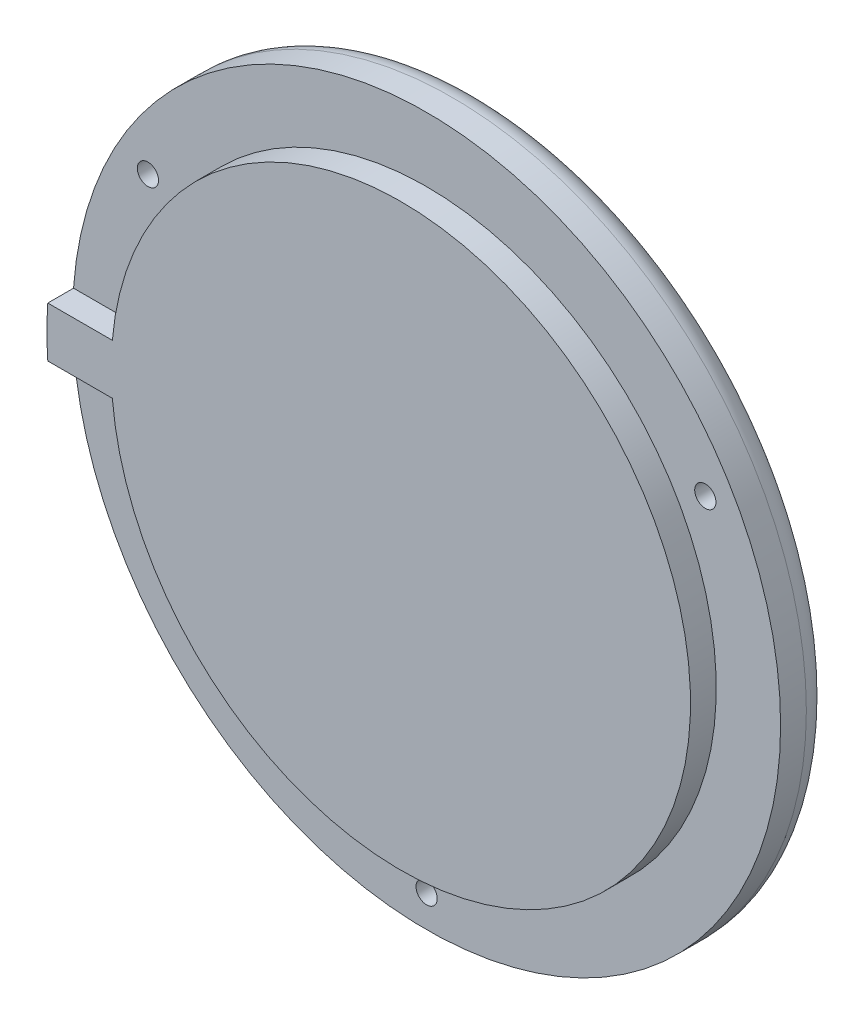
from build123d import *

# Parameters (mm, degrees)
ESBO_O1_R                = 55
RESSALTO_EXTRUS_O1_DEPTH = 8
RESSALTO_EXTRUS_O2_DEPTH = 4
ESBO_O3_R                = 1.65
CORTE_EXTRUS_O1_DEPTH    = 3
ESBO_O4_R                = 2.9
CORTE_EXTRUS_O2_DEPTH    = 5
FILETE1_R                = 4


with BuildPart() as part:
    # Esboço1 → Ressalto-extrusão1 (new body)
    with BuildSketch(Plane.XY):
        Circle(ESBO_O1_R)
    extrude(amount=RESSALTO_EXTRUS_O1_DEPTH)

    # Esboço2 → Ressalto-extrusão2 (add)
    with BuildSketch(Plane.XY.offset(8)):
        with BuildLine():
            Line((-44.830681458, 3.9), (-54.861553022, 3.9))
            ThreePointArc((-54.861553022, 3.9), (-55, 0), (-54.861553022, -3.9))
            Line((-54.861553022, -3.9), (-44.830681458, -3.9))
            ThreePointArc((-44.830681458, -3.9), (45, 0), (-44.830681458, 3.9))
        make_face()
    extrude(amount=RESSALTO_EXTRUS_O2_DEPTH)

    # Esboço3 → Corte-extrusão1 (cut)
    with BuildSketch(Plane.XY.offset(8)):
        with Locations((2.2845e-05, -50)):
            Circle(ESBO_O3_R)
        with Locations((-43.301247344, 25)):
            Circle(ESBO_O3_R)
        with Locations((43.301293034, 25)):
            Circle(ESBO_O3_R)
    extrude(amount=-CORTE_EXTRUS_O1_DEPTH, mode=Mode.SUBTRACT)

    # Esboço4 → Corte-extrusão2 (cut)
    with BuildSketch(Plane.XY.offset(5)):
        with Locations((-43.301247344, 25)):
            Circle(ESBO_O4_R)
        with Locations((43.301293034, 25)):
            Circle(ESBO_O4_R)
        with Locations((2.2845e-05, -50)):
            Circle(ESBO_O4_R)
    extrude(amount=-CORTE_EXTRUS_O2_DEPTH, mode=Mode.SUBTRACT)

    # Filete1
    # the kernel refuses this fillet: 4 mm, written as the material it takes off along each edge
    with BuildSketch(Plane(origin=(0, 0, 0), x_dir=(1, 0, 0), z_dir=(0, -1, 0))) as filete1_piece_1:
        with BuildLine():
            CenterArc((55 - FILETE1_R, FILETE1_R), FILETE1_R, 270, 90)
            Line((55 - FILETE1_R, 0), (55, 0))
            Line((55, 0), (55, FILETE1_R))
        make_face()
    revolve(axis=Axis((0, 0, 0), (0, 0, 1)), mode=Mode.SUBTRACT)


solid = part.part
